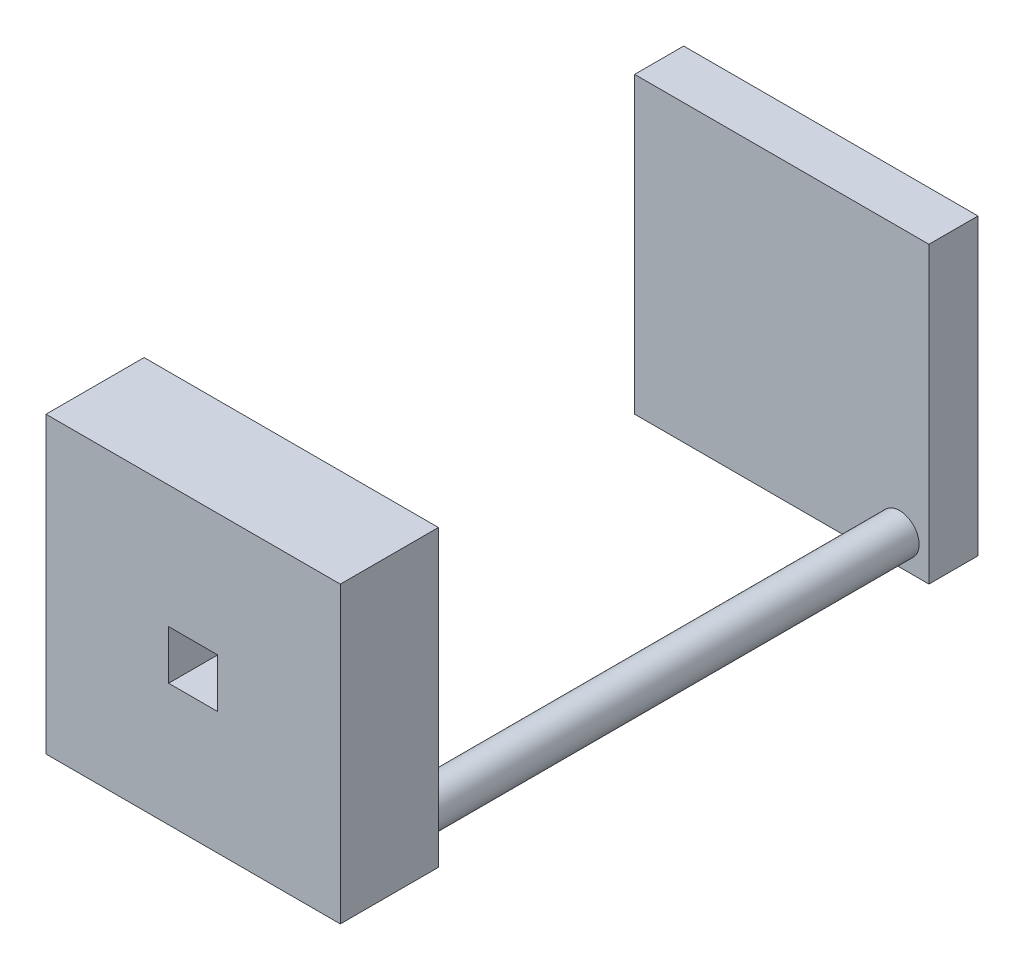
from build123d import *

# Parameters (mm, degrees)
SKETCH1_W           = 30
SKETCH1_H           = 30
BOSS_EXTRUDE1_DEPTH = 10
SKETCH3_R           = 2
BOSS_EXTRUDE4_DEPTH = 50
SKETCH4_W           = 30
SKETCH4_H           = 30
BOSS_EXTRUDE5_DEPTH = 5
CAVITY1_START       = 12.5
CAVITY1_OUTLINE_W   = 5
CAVITY1_OUTLINE_H   = 10
CAVITY1_DEPTH       = 5


# Read off the part's stored shape, not the designer's step: Cavity1
with BuildPart() as part:
    # Sketch1 → Boss-Extrude1 (new body)
    with BuildSketch(Plane.XY):
        with Locations((15, 15)):
            Rectangle(SKETCH1_W, SKETCH1_H)
    extrude(amount=BOSS_EXTRUDE1_DEPTH)

    # Sketch3 → Boss-Extrude4 (add)
    with BuildSketch(Plane(origin=(0, 0, 0), x_dir=(-1, 0, 0), z_dir=(0, 0, -1))):
        with Locations((-27, 3)):
            Circle(SKETCH3_R)
    extrude(amount=BOSS_EXTRUDE4_DEPTH)

    # Sketch4 → Boss-Extrude5 (add)
    with BuildSketch(Plane(origin=(0, 0, -50), x_dir=(-1, 0, 0), z_dir=(0, 0, -1))):
        with Locations((-15, 15)):
            Rectangle(SKETCH4_W, SKETCH4_H)
    extrude(amount=BOSS_EXTRUDE5_DEPTH)

    # Cavity1 outline → Cavity1 (cut)
    with BuildSketch(Plane.YZ.offset(CAVITY1_START)):
        with Locations((15, 5)):
            Rectangle(CAVITY1_OUTLINE_W, CAVITY1_OUTLINE_H)
    extrude(amount=CAVITY1_DEPTH, mode=Mode.SUBTRACT)


solid = part.part
